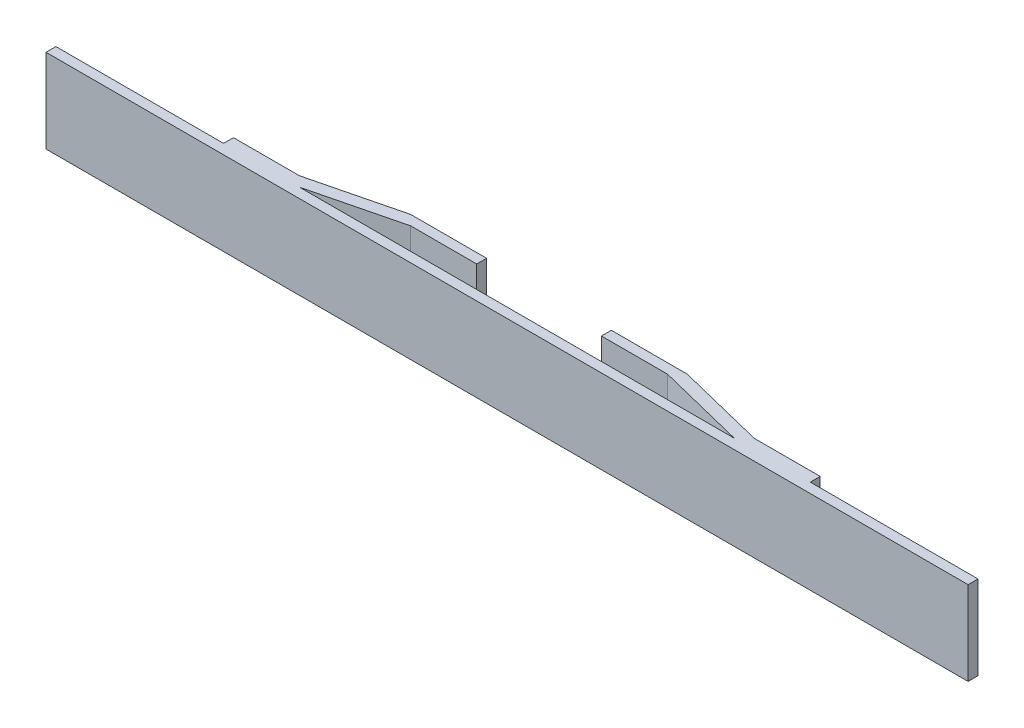
from build123d import *

# Parameters (mm, degrees)
SKETCH1_W           = 304.8
SKETCH1_H           = 25.4
BOSS_EXTRUDE2_DEPTH = 12.7
FILLET1_R           = 12.7
CUT_EXTRUDE3_DEPTH  = 281.209703849
SKETCH8_W           = 70
SKETCH8_H           = 25.4
BOSS_EXTRUDE3_DEPTH = 9.7
CUT_EXTRUDE4_DEPTH  = 281.209703849
CUT_EXTRUDE5_DEPTH  = 281.209703849
SKETCH13_W          = 12.7
SKETCH13_H          = 25.4
CUT_EXTRUDE7_DEPTH  = 280.450243045


with BuildPart() as part:
    # Sketch1 → Boss-Extrude2 (new body)
    with BuildSketch(Plane.XY):
        with Locations((126.366978193, -2.136448598)):
            Rectangle(SKETCH1_W, SKETCH1_H)
    extrude(amount=BOSS_EXTRUDE2_DEPTH)

    # Fillet1
    fillet1_edges = [part.edges().sort_by_distance(p)[0] for p in [
        (-26.033021807, -2.136448598, 12.7),
        (278.766978193, -2.136448598, 12.7),
    ]]
    fillet(fillet1_edges, radius=FILLET1_R - 0.0001)  # a hair under: the kernel refuses the full size

    # Sketch6 → Cut-Extrude3 (cut, through all)
    with BuildSketch(Plane(origin=(0, 10.563551402, 0), x_dir=(1, 0, 0), z_dir=(0, 1, 0))):
        with BuildLine():
            Line((-23.033021807, 0), (275.766978193, 0))
            ThreePointArc((275.766978193, 0), (272.925913971, -6.858935778), (266.066978193, -9.7))
            Line((266.066978193, -9.7), (-13.333021807, -9.7))
            ThreePointArc((-13.333021807, -9.7), (-20.191957584, -6.858935778), (-23.033021807, 0))
        make_face()
    extrude(amount=-CUT_EXTRUDE3_DEPTH, mode=Mode.SUBTRACT)

    # Sketch8 → Boss-Extrude3 (add)
    with BuildSketch(Plane(origin=(0, 0, 9.7), x_dir=(-1, 0, 0), z_dir=(0, 0, -1))):
        with Locations((-180.266978193, -2.136448598)):
            Rectangle(SKETCH8_W, SKETCH8_H)
        with Locations((-72.466978193, -2.136448598)):
            Rectangle(SKETCH8_W, SKETCH8_H)
    extrude(amount=BOSS_EXTRUDE3_DEPTH)

    # Sketch9 → Cut-Extrude4 (cut, through all)
    with BuildSketch(Plane(origin=(0, 10.563551402, 0), x_dir=(1, 0, 0), z_dir=(0, 1, 0))):
        Polygon((145.266978193, -9.7), (165.266978193, -9.7), (192.266978193, -9.7), (165.266978193, -3), (145.266978193, -3), align=None)
        Polygon((215.266978193, -6.7), (195.266978193, -6.7), (168.266978193, 0), (215.266978193, 0), align=None)
    extrude(amount=-CUT_EXTRUDE4_DEPTH, mode=Mode.SUBTRACT)

    # Sketch12 → Cut-Extrude5 (cut, through all)
    with BuildSketch(Plane(origin=(0, 10.563551402, 0), x_dir=(1, 0, 0), z_dir=(0, 1, 0))):
        Polygon((107.466978193, -9.7), (107.466978193, -3), (87.466978193, -3), (60.466978193, -9.7), align=None)
        Polygon((37.466978193, -6.7), (57.466978193, -6.7), (84.466978193, 0), (37.466978193, 0), align=None)
    extrude(amount=-CUT_EXTRUDE5_DEPTH, mode=Mode.SUBTRACT)

    # Sketch13 → Cut-Extrude7 (cut, through all)
    with BuildSketch(Plane.XY.offset(12.7)):
        with Locations((-19.683021807, -2.136448598)):
            Rectangle(SKETCH13_W, SKETCH13_H)
        with Locations((272.416978193, -2.136448598)):
            Rectangle(SKETCH13_W, SKETCH13_H)
    extrude(amount=-CUT_EXTRUDE7_DEPTH, mode=Mode.SUBTRACT)


solid = part.part
